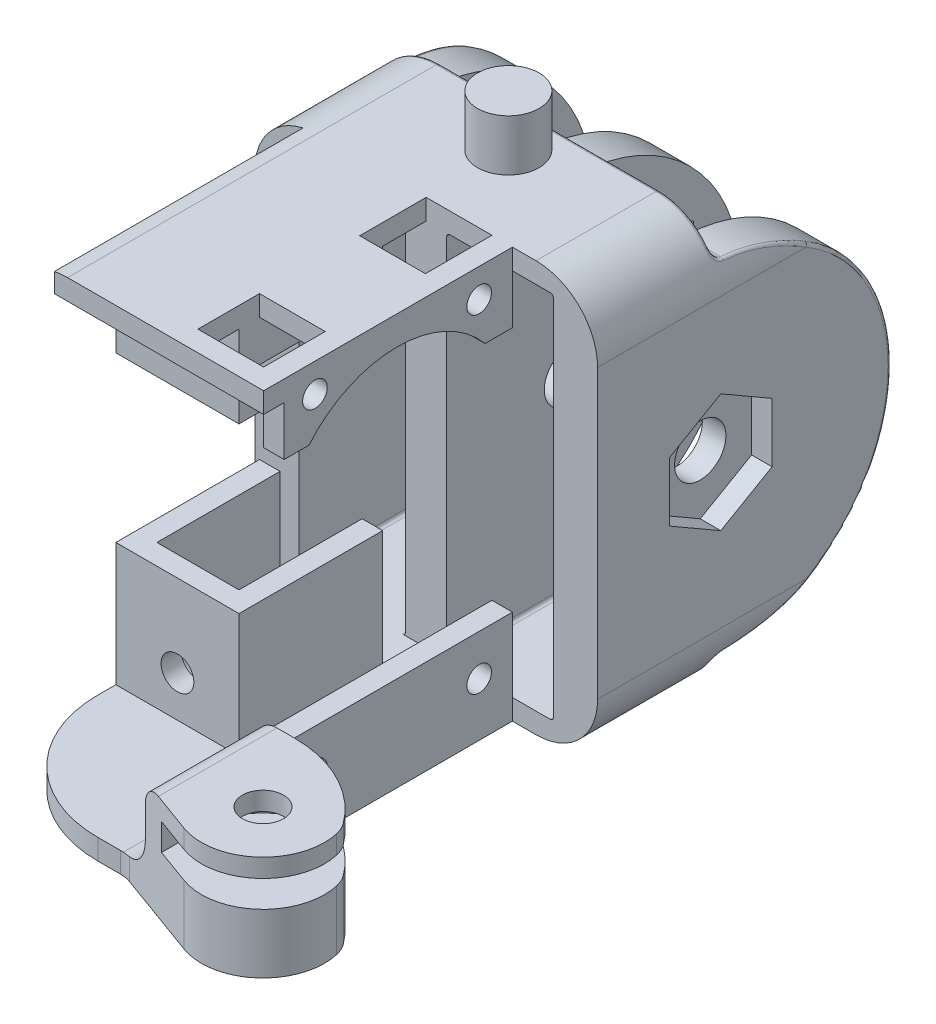
from build123d import *

# Parameters (mm, degrees)
BOSS_EXTRUDE1_DEPTH      = 20
BOSS_EXTRUDE1_DEPTH_BACK = 12
SKETCH1_W                = 16.7
SKETCH1_H                = 20
SKETCH1_W_2              = 12.7
SKETCH1_H_2              = 17
SKETCH9_R                = 1.5
BOSS_EXTRUDE4_DEPTH      = 2.5
BOSS_EXTRUDE5_START      = 2.5
SKETCH10_R               = 1.5
BOSS_EXTRUDE5_DEPTH      = 2.5
EXTRUDE46_START          = -10
EXTRUDE46_DEPTH          = 20
EXTRUDE52_DEPTH          = 27.981932185
EXTRUDE52_DEPTH_BACK     = 27.981932185
EXTRUDE7_DEPTH           = 27.981932185
EXTRUDE7_DEPTH_BACK      = 27.981932185
EXTRUDE8_DEPTH           = 27.981932185
EXTRUDE8_DEPTH_BACK      = 27.981932185
EXTRUDE9_START           = 7.35
EXTRUDE9_DEPTH           = 20.631932185
EXTRUDE48_DEPTH          = 9
EXTRUDE48_DEPTH_BACK     = 9
SKETCH74_W               = 35.058315142
SKETCH74_H               = 29.246113589
SKETCH59_R               = 0.8
EXTRUDE47_DEPTH          = 29.312337381
EXTRUDE49_DEPTH          = 9
EXTRUDE49_DEPTH_BACK     = 9
SKETCH75_W               = 9.907288935
SKETCH75_H               = 19.904321568
EXTRUDE50_DEPTH          = 9
EXTRUDE50_DEPTH_BACK     = 9
SKETCH76_W               = 5.2
SKETCH76_H               = 6.12
SKETCH76_H_2             = 13.03291784
SKETCH76_H_3             = 12.21702605
EXTRUDE56_DEPTH          = 9
EXTRUDE56_DEPTH_BACK     = 9
SKETCH83_W               = 11.907865897
SKETCH83_H               = 2.12
SKETCH83_W_2             = 2
EXTRUDE57_DEPTH          = 9
EXTRUDE57_DEPTH_BACK     = 9
EXTRUDE58_START          = -6
SKETCH85_R               = 2
SKETCH85_R_2             = 0.8
EXTRUDE58_DEPTH          = 6
SKETCH86_W               = 6
SKETCH86_H               = 5
EXTRUDE59_DEPTH          = 1
EXTRUDE60_START          = 4
SKETCH87_W               = 15
SKETCH87_H               = 6.5
EXTRUDE60_DEPTH          = 23.981932185
EXTRUDE61_START          = 4.2
SKETCH90_W               = 5.5
SKETCH90_H               = 10
SKETCH90_W_2             = 5.62
SKETCH90_H_2             = 15
EXTRUDE61_DEPTH          = 23.781932185
EXTRUDE62_START          = 4.2
SKETCH92_W               = 11.12
SKETCH92_H               = 20
EXTRUDE62_DEPTH          = 1
EXTRUDE63_START          = 4.2
SKETCH93_R               = 0.6
EXTRUDE63_DEPTH          = 2
EXTRUDE64_START          = 3.2
SKETCH96_W               = 3
SKETCH96_H               = 4
SKETCH96_W_2             = 3.24
SKETCH96_H_2             = 10
EXTRUDE64_DEPTH          = 3.2
EXTRUDE65_START          = 4.2
EXTRUDE65_DEPTH          = 1
EXTRUDE66_DEPTH          = 1.2
EXTRUDE66_DEPTH_BACK     = 0.1
EXTRUDE66_START          = -7
SKETCH98_R               = 2.75
EXTRUDE67_DEPTH          = 27.981932185
EXTRUDE67_DEPTH_BACK     = 27.981932185
EXTRUDE70_DEPTH          = 2
EXTRUDE70_DEPTH_BACK     = 27.981932185
SKETCH102_R              = 1.25
SKETCH102_R_2            = 1
FILLET1_R                = 3
FILLET2_R                = 0.4
FILLET3_R                = 0.16
FILLET4_R                = 0.16
SKETCH104_W              = 13.082261946
SKETCH104_H              = 5.291872488
SKETCH104_W_2            = 10.658320382
SKETCH104_H_2            = 4.878993339
EXTRUDE72_DEPTH          = 27.981932185
EXTRUDE71_DEPTH          = 2.5
FILLET8_R                = 6
FILLET9_R                = 1.6
FILLET10_R               = 1.6
FILLET11_R               = 1
EXTRUDE73_DEPTH          = 1.5
EXTRUDE74_START          = -7.35
SKETCH106_R              = 1.7
EXTRUDE74_DEPTH          = 20.631932185
FILLET12_R               = 6
FILLET13_R               = 1.6
EXTRUDE75_START          = -7.35
SKETCH109_R              = 2.5
EXTRUDE75_DEPTH          = 20.631932302


with BuildPart() as part:
    # Sketch1 → Boss-Extrude1 (new, two sides: drawn at the far end of the back side and taken through both)
    # profile 1 of 2: a face of its own
    with BuildSketch(Plane.XY.offset(-BOSS_EXTRUDE1_DEPTH_BACK)):
        Rectangle(SKETCH1_W, SKETCH1_H)
        Rectangle(SKETCH1_W_2, SKETCH1_H_2, mode=Mode.SUBTRACT)
    # profile 2 of 2: a face of its own
    with BuildSketch(Plane.XY.offset(-BOSS_EXTRUDE1_DEPTH_BACK)):
        Rectangle(SKETCH1_W_2, SKETCH1_H_2)
    extrude(amount=BOSS_EXTRUDE1_DEPTH + BOSS_EXTRUDE1_DEPTH_BACK)

    # Sketch9 → Boss-Extrude4 (add)
    with BuildSketch(Plane(origin=(0, 10, 0), x_dir=(1, 0, 0), z_dir=(0, 1, 0))):
        with Locations(Location((0, 0, 0), (0, 0, 90))):
            Circle(SKETCH9_R)
    extrude(amount=BOSS_EXTRUDE4_DEPTH)

    # Sketch10 → Boss-Extrude5 (add)
    with BuildSketch(Plane.XZ.offset(10).offset(BOSS_EXTRUDE5_START)):
        with Locations(Location((0, 0, 0), (0, 0, 270))):
            Circle(SKETCH10_R)
    extrude(amount=-BOSS_EXTRUDE5_DEPTH)

    # Extrude46: read off the stored shape, not the designer's step
    # Extrude46 outline → Extrude46 (add)
    with BuildSketch(Plane(origin=(0, 0, 0), x_dir=(1, 0, 0), z_dir=(0, 1, 0)).offset(EXTRUDE46_START)):
        with BuildLine():
            Line((1.38576851, -20), (5.814775305, -21.612026641))
            ThreePointArc((5.814775305, -21.612026641), (8.962156078, -20.914269122), (9.659913597, -17.766888348))
            Line((9.659913597, -17.766888348), (8.35, -14.167930319))
            Line((8.35, -14.167930319), (8.35, -20))
            Line((8.35, -20), (1.38576851, -20))
        make_face()
    extrude(amount=EXTRUDE46_DEPTH)

    # Sketch → Extrude52 (cut, two sides: drawn at the far end of the back side and taken through both)
    with BuildSketch(Plane(origin=(0, 0, 0), x_dir=(1, 0, 0), z_dir=(0, 1, 0)).offset(-EXTRUDE52_DEPTH_BACK)):
        with BuildLine():
            ThreePointArc((7.840835735, -18.792948778), (7.414412171, -17.973796734), (6.498815592, -17.853256158))
            Line((6.498815592, -17.853256158), (6.840835735, -18.792948778))
            ThreePointArc((6.840835735, -18.792948778), (6.368851464, -18.958084853), (5.89288631, -19.111369708))
            ThreePointArc((5.89288631, -19.111369708), (7.002159285, -19.77985035), (7.840835735, -18.792948778))
        make_face()
        with BuildLine():
            Line((6.840835735, -18.792948778), (6.498815592, -17.853256158))
            ThreePointArc((6.498815592, -17.853256158), (5.939881908, -18.359033808), (5.89288631, -19.111369708))
            ThreePointArc((5.89288631, -19.111369708), (6.368851464, -18.958084853), (6.840835735, -18.792948778))
        make_face()
    extrude(amount=EXTRUDE52_DEPTH + EXTRUDE52_DEPTH_BACK, mode=Mode.SUBTRACT)

    # Sketch21 → Extrude7 (cut, two sides: drawn at the far end of the back side and taken through both)
    with BuildSketch(Plane(origin=(0, 0, 0), x_dir=(0, 0, -1), z_dir=(1, 0, 0)).offset(-EXTRUDE7_DEPTH_BACK)):
        with BuildLine():
            ThreePointArc((3.082531755, 0.625), (1.676476194, 1.207407283), (0.75, 0))
            Line((0.75, 0), (2, 0))
            Line((2, 0), (3.082531755, 0.625))
        make_face()
        with BuildLine():
            Line((2, 0), (0.75, 0))
            ThreePointArc((0.75, 0), (2, -1.25), (3.25, 0))
            ThreePointArc((3.25, 0), (3.207407283, 0.323523806), (3.082531755, 0.625))
            Line((3.082531755, 0.625), (2, 0))
        make_face()
    extrude(amount=EXTRUDE7_DEPTH + EXTRUDE7_DEPTH_BACK, mode=Mode.SUBTRACT)

    # Sketch23 → Extrude8 (cut, two sides: drawn at the far end of the back side and taken through both)
    with BuildSketch(Plane(origin=(0, 0, 0), x_dir=(0, 0, -1), z_dir=(1, 0, 0)).offset(-EXTRUDE8_DEPTH_BACK)):
        with BuildLine():
            Line((2, 10), (2, 9.5))
            Line((2, 9.5), (2, 8.3))
            ThreePointArc((2, 8.3), (10.3, 0), (2, -8.3))
            Line((2, -8.3), (2, -10.617918291))
            Line((2, -10.617918291), (2, -11.441587559))
            Line((2, -11.441587559), (19.192940308, -11.441587559))
            Line((19.192940308, -11.441587559), (19.192940308, 11.538339971))
            Line((19.192940308, 11.538339971), (2, 11.538339971))
            Line((2, 11.538339971), (2, 10))
        make_face()
    extrude(amount=EXTRUDE8_DEPTH + EXTRUDE8_DEPTH_BACK, mode=Mode.SUBTRACT)

    # Sketch25 → Extrude9 (cut, through all)
    with BuildSketch(Plane(origin=(0, 0, 0), x_dir=(0, 0, -1), z_dir=(1, 0, 0)).offset(EXTRUDE9_START)):
        Polygon((2, 2.886751346), (-0.5, 1.443375673), (-0.5, -1.443375673), (2, -2.886751346), (4.5, -1.443375673), (4.5, 1.443375673), align=None)
    extrude(amount=EXTRUDE9_DEPTH, mode=Mode.SUBTRACT)

    # Sketch74 → Extrude48 (cut, two sides: drawn at the far end of the back side and taken through both)
    with BuildSketch(Plane(origin=(0, 0, 0), x_dir=(1, 0, 0), z_dir=(0, 1, 0)).offset(-EXTRUDE48_DEPTH_BACK)):
        with Locations((-17.529157571, -27.743056794)):
            Rectangle(SKETCH74_W, SKETCH74_H)
    extrude(amount=EXTRUDE48_DEPTH + EXTRUDE48_DEPTH_BACK, mode=Mode.SUBTRACT)

    # Sketch59 → Extrude47 (cut, through all)
    with BuildSketch(Plane.XY.offset(13.12)):
        with Locations((-3, -7)):
            Circle(SKETCH59_R)
        with Locations((-3, 7)):
            Circle(SKETCH59_R)
    extrude(amount=-EXTRUDE47_DEPTH, mode=Mode.SUBTRACT)

    # Sketch75 → Extrude49 (cut, two sides: drawn at the far end of the back side and taken through both)
    with BuildSketch(Plane(origin=(0, 0, 0), x_dir=(1, 0, 0), z_dir=(0, 1, 0)).offset(-EXTRUDE49_DEPTH_BACK)):
        with Locations((-10.953644468, -13.952160784)):
            Rectangle(SKETCH75_W, SKETCH75_H)
    extrude(amount=EXTRUDE49_DEPTH + EXTRUDE49_DEPTH_BACK, mode=Mode.SUBTRACT)

    # Sketch76 → Extrude50 (cut, two sides: drawn at the far end of the back side and taken through both)
    with BuildSketch(Plane(origin=(0, 0, 0), x_dir=(1, 0, 0), z_dir=(0, 1, 0)).offset(-EXTRUDE50_DEPTH_BACK)):
        with Locations((-3.6, -3.06)):
            Rectangle(SKETCH76_W, SKETCH76_H)
        with Locations((-3.6, 6.51645892)):
            Rectangle(SKETCH76_W, SKETCH76_H_2)
        with Locations((3.6, 6.108513025)):
            Rectangle(SKETCH76_W, SKETCH76_H_3)
        with Locations((3.6, -3.06)):
            Rectangle(SKETCH76_W, SKETCH76_H)
    extrude(amount=EXTRUDE50_DEPTH + EXTRUDE50_DEPTH_BACK, mode=Mode.SUBTRACT)

    # Sketch83 → Extrude56 (cut, two sides: drawn at the far end of the back side and taken through both)
    with BuildSketch(Plane(origin=(0, 0, 0), x_dir=(1, 0, 0), z_dir=(0, 1, 0)).offset(-EXTRUDE56_DEPTH_BACK)):
        with Locations((-5.953932949, -5.06)):
            Rectangle(SKETCH83_W, SKETCH83_H)
        with Locations((1, -5.06)):
            Rectangle(SKETCH83_W_2, SKETCH83_H)
    extrude(amount=EXTRUDE56_DEPTH + EXTRUDE56_DEPTH_BACK, mode=Mode.SUBTRACT)

    # Sketch84 → Extrude57 (cut, two sides: drawn at the far end of the back side and taken through both)
    with BuildSketch(Plane(origin=(0, 0, 0), x_dir=(1, 0, 0), z_dir=(0, 1, 0)).offset(-EXTRUDE57_DEPTH_BACK)):
        Polygon((6.35, -6.12), (0, -6.12), (0, -15.12), (0, -26.754770964), (2.85, -26.754770964), (2.85, -18.792969481), (2.85, -15.12), (6.35, -15.12), align=None)
    extrude(amount=EXTRUDE57_DEPTH + EXTRUDE57_DEPTH_BACK, mode=Mode.SUBTRACT)

    # Sketch85 → Extrude58 (cut)
    # profile 1 of 4: a face of its own
    with BuildSketch(Plane(origin=(0, 0, 6.12), x_dir=(-1, 0, 0), z_dir=(0, 0, -1)).offset(EXTRUDE58_START)):
        with BuildLine():
            Line((6, 0), (0, 0))
            Line((0, 0), (0, -3))
            Line((0, -3), (1, -3))
            Line((1, -3), (1, -7))
            ThreePointArc((1, -7), (3, -5), (5, -7))
            Line((5, -7), (5, -3))
            Line((5, -3), (6, -3))
            Line((6, -3), (6, 0))
        make_face()
    # profile 2 of 4: a face of its own
    with BuildSketch(Plane(origin=(0, 0, 6.12), x_dir=(-1, 0, 0), z_dir=(0, 0, -1)).offset(EXTRUDE58_START)):
        with BuildLine():
            ThreePointArc((5, 7), (3, 5), (1, 7))
            Line((1, 7), (0, 7))
            Line((0, 7), (0, 0))
            Line((0, 0), (6, 0))
            Line((6, 0), (6, 7))
            Line((6, 7), (5, 7))
        make_face()
    # profile 3 of 4: a face of its own
    with BuildSketch(Plane(origin=(0, 0, 6.12), x_dir=(-1, 0, 0), z_dir=(0, 0, -1)).offset(EXTRUDE58_START)):
        with Locations((3, 7)):
            Circle(SKETCH85_R)
        with Locations(Location((3, 7, 0), (0, 0, 180))):
            Circle(SKETCH85_R_2, mode=Mode.SUBTRACT)
    # profile 4 of 4: a face of its own
    with BuildSketch(Plane(origin=(0, 0, 6.12), x_dir=(-1, 0, 0), z_dir=(0, 0, -1)).offset(EXTRUDE58_START)):
        with Locations((3, -7)):
            Circle(SKETCH85_R)
        with Locations(Location((3, -7, 0), (0, 0, 180))):
            Circle(SKETCH85_R_2, mode=Mode.SUBTRACT)
    extrude(amount=EXTRUDE58_DEPTH, mode=Mode.SUBTRACT)

    # Sketch86 → Extrude59 (cut)
    with BuildSketch(Plane(origin=(0, 0, 12.12), x_dir=(-1, 0, 0), z_dir=(0, 0, -1))):
        Polygon((6, 0), (0, 0), (0, -3), (1, -3), (5, -3), (6, -3), align=None)
        with Locations((3, 2.5)):
            Rectangle(SKETCH86_W, SKETCH86_H)
    extrude(amount=-EXTRUDE59_DEPTH, mode=Mode.SUBTRACT)

    # Sketch87 → Extrude60 (cut, through all)
    with BuildSketch(Plane.XY.offset(EXTRUDE60_START)):
        Polygon((0, 2.5), (0, 0), (0, -4.9), (15, -4.9), (15, 2.5), align=None)
        with Locations((7.5, 5.75)):
            Rectangle(SKETCH87_W, SKETCH87_H)
    extrude(amount=EXTRUDE60_DEPTH, mode=Mode.SUBTRACT)

    # Sketch90 → Extrude61 (cut, through all)
    with BuildSketch(Plane(origin=(0, 0, 0), x_dir=(0, 0, -1), z_dir=(1, 0, 0)).offset(EXTRUDE61_START)):
        with Locations((-12.37, 8)):
            Rectangle(SKETCH90_W, SKETCH90_H)
        with Locations((-6.81, 8)):
            Rectangle(SKETCH90_W_2, SKETCH90_H)
        with Locations((-12.37, -4.5)):
            Rectangle(SKETCH90_W, SKETCH90_H_2)
        with Locations((-6.81, -4.5)):
            Rectangle(SKETCH90_W_2, SKETCH90_H_2)
    extrude(amount=EXTRUDE61_DEPTH, mode=Mode.SUBTRACT)

    # Sketch92 → Extrude62 (add)
    with BuildSketch(Plane(origin=(0, 0, 0), x_dir=(0, 0, -1), z_dir=(1, 0, 0)).offset(EXTRUDE62_START)):
        with Locations((-9.56, 0)):
            Rectangle(SKETCH92_W, SKETCH92_H)
    extrude(amount=-EXTRUDE62_DEPTH)

    # Sketch93 → Extrude63 (cut)
    with BuildSketch(Plane(origin=(0, 0, 0), x_dir=(0, 0, -1), z_dir=(1, 0, 0)).offset(EXTRUDE63_START)):
        with Locations((-13.62, 8.6)):
            Circle(SKETCH93_R)
        with Locations((-5.62, 8.6)):
            Circle(SKETCH93_R)
        with Locations((-5.62, -7.4)):
            Circle(SKETCH93_R)
        with Locations((-13.62, -7.4)):
            Circle(SKETCH93_R)
    extrude(amount=-EXTRUDE63_DEPTH, mode=Mode.SUBTRACT)

    # Sketch96 → Extrude64 (cut)
    with BuildSketch(Plane(origin=(0, 0, 0), x_dir=(0, 0, -1), z_dir=(1, 0, 0)).offset(EXTRUDE64_START)):
        with Locations((-13.62, 8.6)):
            Rectangle(SKETCH96_W, SKETCH96_H)
        with Locations((-5.62, 8.6)):
            Rectangle(SKETCH96_W_2, SKETCH96_H)
        with Locations((-13.62, -7.4)):
            Rectangle(SKETCH96_W, SKETCH96_H_2)
        with Locations((-5.62, -7.4)):
            Rectangle(SKETCH96_W_2, SKETCH96_H_2)
    extrude(amount=-EXTRUDE64_DEPTH, mode=Mode.SUBTRACT)

    # Sketch97 → Extrude65 (cut)
    with BuildSketch(Plane(origin=(0, 0, 0), x_dir=(0, 0, -1), z_dir=(1, 0, 0)).offset(EXTRUDE65_START)):
        with BuildLine():
            Line((-9.62, -5.4), (-9.62, -2.6))
            ThreePointArc((-9.62, -2.6), (-13.18791493, -1.316246408), (-15.12, 1.946434625))
            Line((-15.12, 1.946434625), (-15.12, -5.4))
            Line((-15.12, -5.4), (-9.62, -5.4))
        make_face()
        with BuildLine():
            ThreePointArc((-4.02, 3), (-5.660202025, -0.959797975), (-9.62, -2.6))
            Line((-9.62, -2.6), (-9.62, -5.4))
            Line((-9.62, -5.4), (-4, -5.4))
            Line((-4, -5.4), (-4, 6.6))
            Line((-4, 6.6), (-5.330477882, 6.6))
            ThreePointArc((-5.330477882, 6.6), (-4.357808258, 4.915551636), (-4.02, 3))
        make_face()
        with BuildLine():
            Line((-9.62, 6.6), (-9.62, 3))
            Line((-9.62, 3), (-9.62, -2.6))
            ThreePointArc((-9.62, -2.6), (-5.660202025, -0.959797975), (-4.02, 3))
            ThreePointArc((-4.02, 3), (-4.357808258, 4.915551636), (-5.330477882, 6.6))
            Line((-5.330477882, 6.6), (-9.62, 6.6))
        make_face()
        with BuildLine():
            Line((-9.62, -2.6), (-9.62, 3))
            Line((-9.62, 3), (-9.62, 6.6))
            Line((-9.62, 6.6), (-13.909522118, 6.6))
            ThreePointArc((-13.909522118, 6.6), (-14.677644526, 5.404211274), (-15.12, 4.053565375))
            Line((-15.12, 4.053565375), (-15.12, 1.946434625))
            ThreePointArc((-15.12, 1.946434625), (-13.18791493, -1.316246408), (-9.62, -2.6))
        make_face()
        with BuildLine():
            Line((-13.909522118, 6.6), (-9.62, 6.6))
            Line((-9.62, 6.6), (-5.330477882, 6.6))
            ThreePointArc((-5.330477882, 6.6), (-9.62, 8.6), (-13.909522118, 6.6))
        make_face()
        with BuildLine():
            ThreePointArc((-15.12, 4.053565375), (-14.677644526, 5.404211274), (-13.909522118, 6.6))
            Line((-13.909522118, 6.6), (-15.12, 6.6))
            Line((-15.12, 6.6), (-15.12, 4.053565375))
        make_face()
    extrude(amount=-EXTRUDE65_DEPTH, mode=Mode.SUBTRACT)

    # Sketch98 → Extrude66 (cut, two sides: drawn at the far end of the back side and taken through both)
    with BuildSketch(Plane(origin=(0, 0, 0), x_dir=(1, 0, 0), z_dir=(0, 1, 0)).offset(EXTRUDE66_START - EXTRUDE66_DEPTH_BACK)):
        with BuildLine():
            ThreePointArc((9.590835735, -18.792948778), (6.840835735, -21.542948778), (4.090835735, -18.792948778))
            Line((4.090835735, -18.792948778), (4.090835735, -22.968772051))
            ThreePointArc((4.090835735, -22.968772051), (10.376369641, -22.328482684), (11.016659007, -16.042948778))
            Line((11.016659007, -16.042948778), (6.840835735, -16.042948778))
            ThreePointArc((6.840835735, -16.042948778), (8.785379383, -16.84840513), (9.590835735, -18.792948778))
        make_face()
        with Locations((6.840835735, -18.792948778)):
            Circle(SKETCH98_R)
    extrude(amount=EXTRUDE66_DEPTH + EXTRUDE66_DEPTH_BACK, mode=Mode.SUBTRACT)

    # Sketch99 → Extrude67 (cut, two sides: drawn at the far end of the back side and taken through both)
    with BuildSketch(Plane(origin=(0, 0, 0), x_dir=(1, 0, 0), z_dir=(0, 1, 0)).offset(-EXTRUDE67_DEPTH_BACK)):
        Polygon((-14.945243079, -4), (-6.35, -4), (-6, -4), (-6, -22.025847639), (-14.945243079, -22.025847639), align=None)
    extrude(amount=EXTRUDE67_DEPTH + EXTRUDE67_DEPTH_BACK, mode=Mode.SUBTRACT)

    # Sketch102 → Extrude70 (cut, two sides: drawn at the far end of the back side and taken through both)
    with BuildSketch(Plane(origin=(0, 0, 0), x_dir=(0, 0, -1), z_dir=(1, 0, 0)).offset(-EXTRUDE70_DEPTH_BACK)):
        with Locations((2, 0)):
            Circle(SKETCH102_R)
        with Locations((6.330127019, 2.5)):
            Circle(SKETCH102_R_2)
    extrude(amount=EXTRUDE70_DEPTH + EXTRUDE70_DEPTH_BACK, mode=Mode.SUBTRACT)

    # Fillet1
    fillet1_edges = [part.edges().sort_by_distance(p)[0] for p in [
        (-8.35, -10, 1),
        (8.35, -10, 1),
        (-8.35, 10, 1),
        (8.35, 10, 1),
    ]]
    fillet(fillet1_edges, radius=FILLET1_R)

    # Fillet2
    fillet2_edges = [part.edges().sort_by_distance(p)[0] for p in [
        (0, -8.3, -2),
        (7.126850583, 8.3, -2),
        (7.126850583, -8.3, -2),
        (-7.126850583, -8.3, -2),
        (-7.126850583, 8.3, -2),
        (0, 8.3, -2),
    ]]
    fillet(fillet2_edges, radius=FILLET2_R)

    # Fillet3
    fillet3_edges = [part.edges().sort_by_distance(p)[0] for p in [
        (-1, 9, 1),
        (-6.2, -9, 1),
        (-6.2, 9, 1),
        (-1, -9, 1),
        (1, -9, 1),
        (1, 9, 1),
        (6.2, 9, 1),
        (6.2, -9, 1),
    ]]
    fillet(fillet3_edges, radius=FILLET3_R)

    # Fillet4
    fillet4_edges = [part.edges().sort_by_distance(p)[0] for p in [
        (-8.35, 0, -10.3),
        (0, -10, -2),
        (-6.751356629, -9.652583571, -2),
        (-8.207733347, 7.912885637, -4.505242684),
        (8.35, 0, -10.3),
        (8.207733346, -7.912885637, -4.505242684),
        (0, 10, -2),
        (6.751356629, 9.652583571, -2),
        (6.751356629, -9.652583571, -2),
        (8.207733347, 7.912885637, -4.505242684),
        (-8.207733346, -7.912885637, -4.505242684),
        (-6.751356629, 9.652583571, -2),
        (7.988976237, -8.426816224, -2.099479305),
        (-7.988976237, -8.426816224, -2.099479305),
        (-7.988976237, 8.426816224, -2.099479305),
        (7.988976237, 8.426816224, -2.099479305),
    ]]
    fillet(fillet4_edges, radius=FILLET4_R)

    # Sketch104 → Extrude72 (cut, through all)
    with BuildSketch(Plane(origin=(0, 0, 0), x_dir=(1, 0, 0), z_dir=(0, 1, 0))):
        with Locations((-6.541130973, -18.765936244)):
            Rectangle(SKETCH104_W, SKETCH104_H)
        Polygon((4.2, -16.12), (0, -16.12), (0, -21.411872488), (0, -22.703312407), (4.2, -22.703312407), align=None)
        Polygon((14.858320382, -16.12), (4.2, -16.12), (4.2, -22.703312407), (4.2, -24.102569067), (15.784352876, -24.102569067), (15.784352876, -16.12), align=None)
        with Locations((9.529160191, -13.680503331)):
            Rectangle(SKETCH104_W_2, SKETCH104_H_2)
    extrude(amount=EXTRUDE72_DEPTH, mode=Mode.SUBTRACT)

    # Sketch103 → Extrude71 (cut)
    with BuildSketch(Plane.XZ.offset(10)):
        Polygon((6.840835735, 20.755939694), (5.140835735, 19.774444236), (5.140835735, 17.811453321), (6.840835735, 16.829957863), (8.540835735, 17.811453321), (8.540835735, 19.774444236), align=None)
    extrude(amount=-EXTRUDE71_DEPTH, mode=Mode.SUBTRACT)

    # Fillet8
    fillet8_edges = [part.edges().sort_by_distance(p)[0] for p in [
        (-6, -9.464368465, 20),
    ]]
    fillet(fillet8_edges, radius=FILLET8_R)

    # Fillet9
    fillet9_edges = [part.edges().sort_by_distance(p)[0] for p in [
        (1.38576851, -9.5, 20),
    ]]
    fillet(fillet9_edges, radius=FILLET9_R)

    # Fillet10
    fillet10_edges = [part.edges().sort_by_distance(p)[0] for p in [
        (2.85, -9, 17.826468339),
    ]]
    fillet(fillet10_edges, radius=FILLET10_R)

    # Fillet11
    fillet11_edges = [part.edges().sort_by_distance(p)[0] for p in [
        (2.85, -4.9, 17.826468339),
    ]]
    fillet(fillet11_edges, radius=FILLET11_R)

    # Sketch105 → Extrude73 (cut)
    with BuildSketch(Plane(origin=(1, 0, 0), x_dir=(0, 0, -1), z_dir=(1, 0, 0))):
        Polygon((6.330127019, 4.462990915), (4.630127019, 3.481495458), (4.630127019, 1.518504542), (6.330127019, 0.537009085), (8.030127019, 1.518504542), (8.030127019, 3.481495458), align=None)
    extrude(amount=-EXTRUDE73_DEPTH, mode=Mode.SUBTRACT)

    # Sketch106 → Extrude74 (cut, through all)
    with BuildSketch(Plane(origin=(0, 0, 0), x_dir=(0, 0, -1), z_dir=(1, 0, 0)).offset(EXTRUDE74_START)):
        with Locations((6.330127019, 2.5)):
            Circle(SKETCH106_R)
    extrude(amount=-EXTRUDE74_DEPTH, mode=Mode.SUBTRACT)

    # Fillet12
    # the kernel refuses this fillet: 6 mm, written as the material it takes off along each edge
    with BuildSketch(Plane(origin=(8.696525025, -20.030540349, 15.12), x_dir=(-1, 0, 0), z_dir=(0, 1, 0))) as fillet12_piece_1:
        with BuildLine():
            CenterArc((4.01221614, 6), FILLET12_R, 213.976439011, 56.023560989)
            Line((-0.963388572, 2.646888348), (0, 0))
            Line((0, 0), (4.01221614, 0))
        make_face()
    extrude(amount=25.161080699, mode=Mode.SUBTRACT)

    # Fillet13
    fillet13_edges = [part.edges().sort_by_distance(p)[0] for p in [
        (9.659913597, -8.55, 17.766888348),
        (9.659913597, -5.35, 17.766888348),
    ]]
    fillet(fillet13_edges, radius=FILLET13_R)

    # Sketch109 → Extrude75 (cut, through all)
    with BuildSketch(Plane(origin=(0, 0, 0), x_dir=(0, 0, -1), z_dir=(1, 0, 0)).offset(EXTRUDE75_START)):
        with Locations((2, 0)):
            Circle(SKETCH109_R)
    extrude(amount=-EXTRUDE75_DEPTH, mode=Mode.SUBTRACT)


solid = part.part
